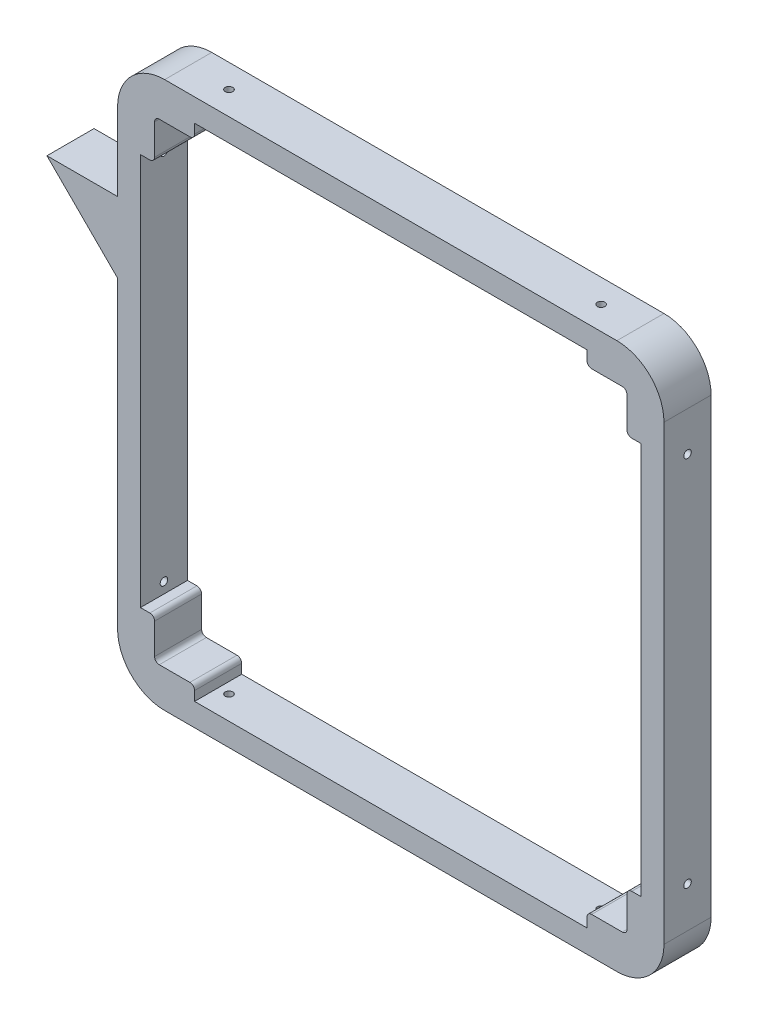
from build123d import *

# Parameters (mm, degrees)
BASE_DEPTH                     = 5
ARM_DEPTH                      = 5
CUT_EXTRUDE1_DEPTH             = 91.09217483320299
BOSS_EXTRUDE4_DEPTH            = 7
BOSS_EXTRUDE5_DEPTH            = 4
BOSS_EXTRUDE6_DEPTH            = 1
CLEARANCE_DEPTH                = 20
M2X0_4_TAPPED_HOLE1_AT_2_COUNT = 2
M2X0_4_TAPPED_HOLE1_AT_2_PITCH = 79
M2X0_4_TAPPED_HOLE2_AT_2_COUNT = 2
M2X0_4_TAPPED_HOLE2_AT_2_PITCH = 79
EXTENDER_DEPTH                 = 18.310000000000002
ANGLED_HORIZONTAL_DEPTH        = 30.405592
BOSS_EXTRUDE9_DEPTH            = 4
BOSS_EXTRUDE10_DEPTH           = 1
BOSS_EXTRUDE11_START           = -5
BOSS_EXTRUDE11_DEPTH           = 10
FILLET1_R                      = 1
FILLET2_R                      = 10
SPLIT1_START                   = -38.162950904
SPLIT1_DEPTH                   = 33.162950904


# Read off the part's stored shape, not the designer's step: Split1
with BuildPart() as part:
    # Sketch1 → base (new, symmetric)
    with BuildSketch(Plane.XY):
        Polygon((58.00000000000011, 58.00000000000005), (58.00000000000011, -58.00000000000005), (-58.00000000000008, -58.00000000000009), (-58.00000000000008, 58.00000000000009), align=None)
        Polygon((-41.5, 53.00000000000001), (41.5, 53.00000000000001), (41.5, 50.00188016), (50.00188015999998, 50.00188015999996), (50.00188015999998, 41.49999999999998), (52.999999999999986, 41.49999999999998), (52.999999999999986, -41.49999999999998), (50.00188015999996, -41.499999999999964), (50.00188015999999, -50.001880160000006), (41.499999999999964, -50.00188015999996), (41.49999999999998, -52.99999999999998), (-41.5, -53.00000000000001), (-41.5, -50.00188016), (-50.00188015999999, -50.001880160000006), (-50.00188015999996, -41.499999999999964), (-52.999999999999986, -41.49999999999998), (-52.999999999999986, 41.49999999999998), (-50.00188015999998, 41.49999999999998), (-50.00188015999998, 50.00188015999996), (-41.5, 50.00188016), align=None, mode=Mode.SUBTRACT)
    extrude(amount=BASE_DEPTH, both=True)

    # Sketch2 → arm (add, symmetric)
    with BuildSketch(Plane(origin=(0, 0, 0), x_dir=(0.7071067811865476, -0.7071067811865475, 0), z_dir=(0.7071067811865475, 0.7071067811865476, 0))):
        Polygon((70.9254691007821, 5), (82.02438661763962, 5), (82.02438661763962, 23.310000000000002), (5.0243866176396255, 23.30999999999999), (16.33438661763979, 12), (70.9254691007821, 12), align=None)
    extrude(amount=ARM_DEPTH, both=True)

    # Sketch3 → Cut-Extrude1 (cut, through all)
    with BuildSketch(Plane.XY):
        Polygon((54.81801948466061, -61.889087296526085), (61.88908729652609, -54.81801948466061), (58.00000000000011, -50.928932188134624), (58.0000000000001, -58.00000000000005), (50.92893218813458, -58.00000000000006), align=None)
    extrude(amount=-CUT_EXTRUDE1_DEPTH, mode=Mode.SUBTRACT)

    # Sketch5 → Boss-Extrude4 (add)
    with BuildSketch(Plane(origin=(0, 0, -5), x_dir=(-1, 0, 0), z_dir=(0, 0, -1))):
        Polygon((-50.15188015999995, -50.151880159999976), (-46.61634625406723, -53.68741406593269), (-43.080812348134494, -50.15188015999998), align=None)
        Polygon((-53.68741406593271, -46.61634625406722), (-50.15188015999995, -50.151880159999976), (-50.15188015999996, -43.08081234813448), align=None)
    extrude(amount=BOSS_EXTRUDE4_DEPTH)

    # Sketch9 → Boss-Extrude5 (add)
    with BuildSketch(Plane(origin=(10.01771845904714, -10.017718459047138, -14.167193308819991), x_dir=(0.8660254037844407, 0.2886751345948079, 0.40824829046386213), z_dir=(-0.4999999999999964, 0.4999999999999963, 0.7071067811865527))):
        Polygon((-9.25319791566329, -10.296687914526352), (12.79220976938526, 5.291769353593638), (-8.569750190631026, 35.50214284791941), (-30.61515787567957, 19.913685579799417), align=None)
        Polygon((-8.80889650236913, 34.10829599780206), (-29.221311025562215, 19.67453926806133), (-9.014051603925173, -8.902841064409014), (11.39836291926792, 5.530915665331709), align=None, mode=Mode.SUBTRACT)
    extrude(amount=BOSS_EXTRUDE5_DEPTH)

    # Sketch9<2> → Boss-Extrude6 (add)
    with BuildSketch(Plane(origin=(10.01771845904714, -10.017718459047138, -14.167193308819991), x_dir=(0.8660254037844407, 0.2886751345948079, 0.40824829046386213), z_dir=(-0.4999999999999964, 0.4999999999999963, 0.7071067811865527))):
        Polygon((-9.014051603925173, -8.902841064409014), (11.39836291926792, 5.530915665331709), (-8.80889650236913, 34.10829599780206), (-29.221311025562215, 19.67453926806133), align=None)
    extrude(amount=BOSS_EXTRUDE6_DEPTH)

    # Sketch7 → clearance (cut)
    with BuildSketch(Plane.XY.offset(15)):
        Polygon((-41.65, 53.150000000000006), (41.649999999999984, 53.150000000000006), (41.649999999999984, 50.15188016), (50.151880159999976, 50.15188016), (50.151880159999976, 41.64999999999998), (53.149999999999984, 41.64999999999998), (53.14999999999999, -41.64999999999996), (50.15188015999996, -41.64999999999996), (50.15188015999996, -50.15188015999998), (41.64999999999998, -50.15188015999998), (41.64999999999998, -53.14999999999998), (-41.65, -53.149999999999984), (-41.65, -50.15188016), (-50.15188015999999, -50.15188016), (-50.15188015999999, -41.64999999999998), (-53.149999999999984, -41.64999999999998), (-53.149999999999984, 41.64999999999998), (-50.151880159999976, 41.64999999999998), (-50.151880159999976, 50.15188015999996), (-41.65, 50.15188015999996), align=None)
    extrude(amount=-CLEARANCE_DEPTH, mode=Mode.SUBTRACT)

    # Sketch12 → M2x0.4 Tapped Hole1 (revolve, cut)
    with BuildSketch(Plane(origin=(-39.350000000000016, 0, 0), x_dir=(0, 0, -1), z_dir=(1, 0, 0))):
        Polygon((0, 0), (-1.421e-14, 58.00000000000009), (0.7999999999999855, 58.00000000000009), (0.7999999999999883, -1.46e-15), align=None)
    m2x0_4_tapped_hole1 = revolve(axis=Axis((-39.350000000000016, -6.349999999999991, 0), (0, 1, 0)), mode=Mode.SUBTRACT)

    # M2x0.4 Tapped Hole1 at 2: M2x0.4 Tapped Hole1 ×2
    with Locations(*[(i * M2X0_4_TAPPED_HOLE1_AT_2_PITCH, 0, 0) for i in range(1, M2X0_4_TAPPED_HOLE1_AT_2_COUNT)]):
        add(m2x0_4_tapped_hole1, mode=Mode.SUBTRACT)

    # Mirror1: M2x0.4 Tapped Hole1 across plane
    add(m2x0_4_tapped_hole1.mirror(Plane.ZX), mode=Mode.SUBTRACT)

    # Mirror1 copy 1 sketch → Mirror1 copy 1 (revolve, cut)
    with BuildSketch(Plane(origin=(39.649999999999984, 0, 0), x_dir=(0, 0, -1), z_dir=(1, 0, 0))):
        Polygon((0, 0), (-1.421e-14, -58.00000000000009), (0.7999999999999855, -58.00000000000009), (0.7999999999999883, 1.46e-15), align=None)
    revolve(axis=Axis((39.649999999999984, 6.349999999999991, 0), (0, 1, 0)), mode=Mode.SUBTRACT)

    # Sketch15 → M2x0.4 Tapped Hole2 (revolve, cut)
    with BuildSketch(Plane.ZX.offset(39.65)):
        Polygon((0, 0), (-1.421e-14, 58.00000000000011), (0.7999999999999923, 58.00000000000011), (0.7999999999999883, -1.46e-15), align=None)
    m2x0_4_tapped_hole2 = revolve(axis=Axis((-6.349999999999991, 39.65, 0), (1, 0, 0)), mode=Mode.SUBTRACT)

    # M2x0.4 Tapped Hole2 at 2: M2x0.4 Tapped Hole2 ×2
    with Locations(*[(0, -i * M2X0_4_TAPPED_HOLE2_AT_2_PITCH, 0) for i in range(1, M2X0_4_TAPPED_HOLE2_AT_2_COUNT)]):
        add(m2x0_4_tapped_hole2, mode=Mode.SUBTRACT)

    # Mirror2: M2x0.4 Tapped Hole2 across plane
    add(m2x0_4_tapped_hole2.mirror(Plane(origin=(0, 0, 0), x_dir=(0, 0, 1), z_dir=(1, 0, 0))), mode=Mode.SUBTRACT)

    # Mirror2 copy 1 sketch → Mirror2 copy 1 (revolve, cut)
    with BuildSketch(Plane.ZX.offset(-39.35)):
        Polygon((0, 0), (-1.421e-14, -58.00000000000011), (0.7999999999999923, -58.00000000000011), (0.7999999999999883, 1.46e-15), align=None)
    revolve(axis=Axis((6.349999999999991, -39.35, 0), (1, 0, 0)), mode=Mode.SUBTRACT)

    # Sketch16 → extender (add)
    with BuildSketch(Plane(origin=(0, 0, -5), x_dir=(-1, 0, 0), z_dir=(0, 0, -1))):
        Polygon((53.149999999999984, 21.649999999999977), (109.71854249492377, 78.21854249492374), (109.71854249492377, 68.21854249492375), (53.14999999999998, 11.649999999999949), align=None)
    extrude(amount=EXTENDER_DEPTH)

    # Sketch17 → angled horizontal (add)
    with BuildSketch(Plane(origin=(-15.749999999999996, -15.75, 0), x_dir=(0.7071067811865476, -0.7071067811865475, 0), z_dir=(0.7071067811865475, 0.7071067811865476, 0))):
        Polygon((-132.8915872327537, 23.310000000000006), (-132.8915872327537, 5), (-121.58158723275366, 5), (-121.58158723275366, 12), (-110.27158723275356, 23.310000000000006), align=None)
    extrude(amount=ANGLED_HORIZONTAL_DEPTH)

    # Sketch19 → Boss-Extrude9 (add)
    with BuildSketch(Plane(origin=(-47.228223086970885, 47.22822308697087, -66.79079361637689), x_dir=(0.8660254037844398, 0.2886751345948101, -0.4082482904638625), z_dir=(0.49999999999999806, -0.4999999999999979, 0.7071067811865506))):
        Polygon((-55.75778860387471, 55.47372790481981), (-34.39582864385848, 25.263354410494006), (-12.350420958809925, 40.85181167861396), (-33.71238091882616, 71.06218517293976), align=None)
        Polygon((-54.36394175375736, 55.234581593081714), (-33.95152723056426, 69.66833832282242), (-13.744267808927273, 41.09095799035208), (-34.15668233212039, 26.65720126061137), align=None, mode=Mode.SUBTRACT)
    extrude(amount=BOSS_EXTRUDE9_DEPTH)

    # Sketch19<2> → Boss-Extrude10 (add)
    with BuildSketch(Plane(origin=(-47.228223086970885, 47.22822308697087, -66.79079361637689), x_dir=(0.8660254037844398, 0.2886751345948101, -0.4082482904638625), z_dir=(0.49999999999999806, -0.4999999999999979, 0.7071067811865506))):
        Polygon((-34.15668233212039, 26.65720126061137), (-54.36394175375736, 55.234581593081714), (-33.95152723056426, 69.66833832282242), (-13.744267808927273, 41.09095799035208), align=None)
    extrude(amount=BOSS_EXTRUDE10_DEPTH)

    # Sketch21 → Boss-Extrude11 (add)
    with BuildSketch(Plane.XY.offset(BOSS_EXTRUDE11_START)):
        Polygon((-58.00000000000008, 16.500000000000064), (-58.00000000000008, 31.500000000000057), (-73.00000000000009, 31.500000000000057), align=None)
    extrude(amount=BOSS_EXTRUDE11_DEPTH)

    # Fillet1
    fillet1_edges = [part.edges().sort_by_distance(p)[0] for p in [
        (50.15188015999996, -50.151880159999976, -3.5),
        (-41.65, 50.15188015999996, 0),
        (41.649999999999984, 50.15188016, 0),
        (50.151880159999976, 50.15188016, 0),
        (50.151880159999976, 41.64999999999998, 0),
        (50.15188015999996, -41.64999999999996, 0),
        (41.64999999999998, -50.15188015999998, 0),
        (-41.65, -50.15188016, 0),
        (-50.15188015999999, -50.15188016, 0),
        (-50.15188015999999, -41.64999999999998, 0),
        (-50.151880159999976, 41.64999999999998, 0),
        (-50.151880159999976, 50.15188015999996, 0),
    ]]
    fillet(fillet1_edges, radius=FILLET1_R)

    # Fillet2
    fillet2_edges = [part.edges().sort_by_distance(p)[0] for p in [
        (58.0000000000001, -58.00000000000005, -9.155000000000001),
        (58.00000000000011, 58.00000000000005, 0),
        (-58.00000000000008, 58.00000000000009, 0),
        (-58.00000000000008, -58.00000000000009, 0),
    ]]
    fillet(fillet2_edges, radius=FILLET2_R)

    # Split1 outline → Split1 (cut)
    with BuildSketch(Plane.XY.offset(SPLIT1_START)):
        with BuildLine():
            Line((-53.15, 11.65), (-53.15, 34.058116908))
            Line((-53.15, 34.058116908), (31.059997068, -50.15188016))
            Line((31.059997068, -50.15188016), (43.080812348, -50.15188016))
            Line((43.080812348, -50.15188016), (50.588190451, -57.659258263))
            ThreePointArc((50.588190451, -57.659258263), (55.071067812, -55.071067812), (57.659258263, -50.588190451))
            Line((57.659258263, -50.588190451), (50.15188016, -43.080812348))
            Line((50.15188016, -43.080812348), (50.15188016, -31.059997068))
            Line((50.15188016, -31.059997068), (-53.15, 72.241883092))
            Line((-53.15, 72.241883092), (-53.15, 72.24432683))
            Line((-53.15, 72.24432683), (-76.424001385, 95.518328215))
            Line((-76.424001385, 95.518328215), (-80.2211648, 91.7211648))
            Line((-80.2211648, 91.7211648), (-88.218542495, 99.718542495))
            Line((-88.218542495, 99.718542495), (-109.718542495, 78.218542495))
            Line((-109.718542495, 78.218542495), (-109.718542495, 68.218542495))
            Line((-109.718542495, 68.218542495), (-53.15, 11.65))
        make_face()
    extrude(amount=SPLIT1_DEPTH, mode=Mode.SUBTRACT)


solid = part.part
